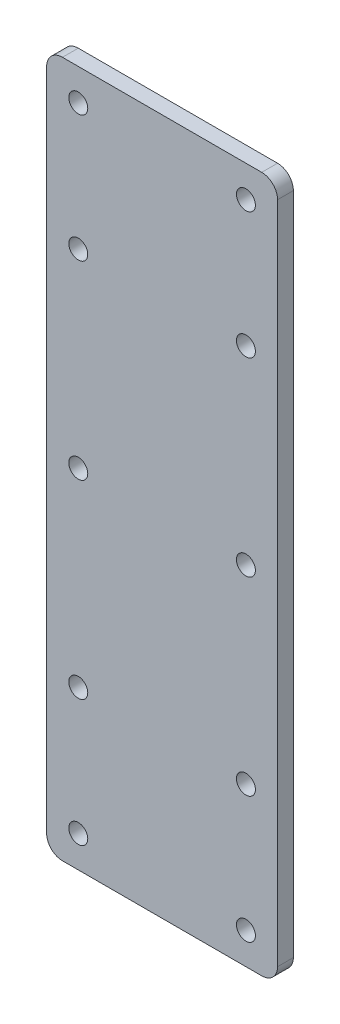
from build123d import *

# Parameters (mm, degrees)
SKETCH2_R           = 3
BOSS_EXTRUDE1_DEPTH = 5


with BuildPart() as part:
    # Sketch2 → Boss-Extrude1 (new body)
    with BuildSketch(Plane.XY):
        with BuildLine():
            ThreePointArc((0, 5), (1.464466094, 1.464466094), (5, 0))
            Line((5, 0), (68, 0))
            ThreePointArc((68, 0), (71.535533906, 1.464466094), (73, 5))
            Line((73, 5), (73, 215))
            ThreePointArc((73, 215), (71.535533906, 218.535533906), (68, 220))
            Line((68, 220), (5, 220))
            ThreePointArc((5, 220), (1.464466094, 218.535533906), (0, 215))
            Line((0, 215), (0, 5))
        make_face()
        with Locations((10, 50)):
            Circle(SKETCH2_R, mode=Mode.SUBTRACT)
        with Locations((10, 10)):
            Circle(SKETCH2_R, mode=Mode.SUBTRACT)
        with Locations((63, 10)):
            Circle(SKETCH2_R, mode=Mode.SUBTRACT)
        with Locations((63, 50)):
            Circle(SKETCH2_R, mode=Mode.SUBTRACT)
        with Locations((10, 110)):
            Circle(SKETCH2_R, mode=Mode.SUBTRACT)
        with Locations((63, 110)):
            Circle(SKETCH2_R, mode=Mode.SUBTRACT)
        with Locations((10, 210)):
            Circle(SKETCH2_R, mode=Mode.SUBTRACT)
        with Locations((10, 170)):
            Circle(SKETCH2_R, mode=Mode.SUBTRACT)
        with Locations((63, 170)):
            Circle(SKETCH2_R, mode=Mode.SUBTRACT)
        with Locations((63, 210)):
            Circle(SKETCH2_R, mode=Mode.SUBTRACT)
    extrude(amount=BOSS_EXTRUDE1_DEPTH)


solid = part.part
